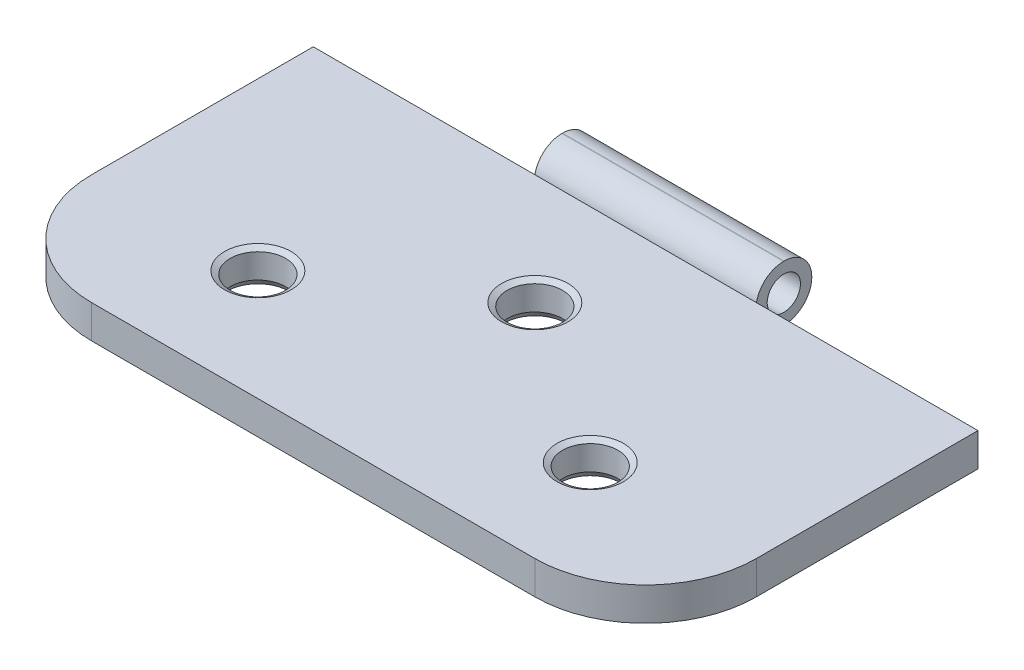
from build123d import *
from OCP.BRepFilletAPI import BRepFilletAPI_MakeChamfer

# Parameters (mm, degrees)
SZKIC1_W                    = 60
SZKIC1_H                    = 30
DODANIE_WYCI_GNI_CIE1_DEPTH = 3
SZKIC2_R                    = 2.5
WYTNIJ_WYCI_GNI_CIE1_DEPTH  = 5
ZAOKR_GLENIE1_R             = 10
SZKIC3_W                    = 20
SZKIC3_H                    = 3
DODANIE_WYCI_GNI_CIE2_DEPTH = 5
SZKIC4_W                    = 20
SZKIC4_H                    = 5
DODANIE_WYCI_GNI_CIE3_DEPTH = 2
ZAOKR_GLENIE2_R             = 2.5
SZKIC5_R                    = 1.5
WYTNIJ_WYCI_GNI_CIE2_DEPTH  = 20
SFAZOWANIE1_SIZE            = 0.5
SFAZOWANIE1_SIZE2           = 0.288675135
SFAZOWANIE2_SIZE            = 0.5
SFAZOWANIE2_SIZE2           = 0.288675135


with BuildPart() as part:
    # Szkic1 → Dodanie-wyciągnięcie1 (new body)
    with BuildSketch(Plane(origin=(0, 0, 0), x_dir=(1, 0, 0), z_dir=(0, 1, 0))):
        Rectangle(SZKIC1_W, SZKIC1_H)
    extrude(amount=DODANIE_WYCI_GNI_CIE1_DEPTH)

    # Szkic2 → Wytnij-wyciągnięcie1 (cut)
    with BuildSketch(Plane(origin=(0, 3, 0), x_dir=(1, 0, 0), z_dir=(0, 1, 0))):
        with Locations(Location((-15, -5, 0), (0, 0, 270))):
            Circle(SZKIC2_R)
        with Locations(Location((15, -5, 0), (0, 0, 270))):
            Circle(SZKIC2_R)
        with Locations(Location((0, 5, 0), (0, 0, 270))):
            Circle(SZKIC2_R)
    extrude(amount=-WYTNIJ_WYCI_GNI_CIE1_DEPTH, mode=Mode.SUBTRACT)

    # Zaokrąglenie1
    zaokr_glenie1_edges = [part.edges().sort_by_distance(p)[0] for p in [
        (30, 1.5, 15),
        (-30, 1.5, 15),
    ]]
    fillet(zaokr_glenie1_edges, radius=ZAOKR_GLENIE1_R)

    # Szkic3 → Dodanie-wyciągnięcie2 (add)
    with BuildSketch(Plane(origin=(0, 0, -15), x_dir=(-1, 0, 0), z_dir=(0, 0, -1))):
        with Locations((0, 1.5)):
            Rectangle(SZKIC3_W, SZKIC3_H)
    extrude(amount=DODANIE_WYCI_GNI_CIE2_DEPTH)

    # Szkic4 → Dodanie-wyciągnięcie3 (add)
    with BuildSketch(Plane(origin=(0, 3, 0), x_dir=(1, 0, 0), z_dir=(0, 1, 0))):
        with Locations((0, 17.5)):
            Rectangle(SZKIC4_W, SZKIC4_H)
    extrude(amount=DODANIE_WYCI_GNI_CIE3_DEPTH)

    # Zaokrąglenie2
    # the kernel refuses this fillet: 2.5 mm, written as the material it takes off along each edge
    with BuildSketch(Plane(origin=(16.25, 0, -20), x_dir=(0, 1, 0), z_dir=(-1, 0, 0)), Plane(origin=(16.25, 5, -20), x_dir=(0, 0, 1), z_dir=(-1, 0, 0))) as zaokr_glenie2_piece_1:
        with BuildLine():
            CenterArc((ZAOKR_GLENIE2_R, -ZAOKR_GLENIE2_R), ZAOKR_GLENIE2_R, 90, 90)
            Line((0, -ZAOKR_GLENIE2_R), (-ZAOKR_GLENIE2_R * 0.02, -ZAOKR_GLENIE2_R))
            Line((-ZAOKR_GLENIE2_R * 0.02, -ZAOKR_GLENIE2_R), (-ZAOKR_GLENIE2_R * 0.02, ZAOKR_GLENIE2_R * 0.02))
            Line((-ZAOKR_GLENIE2_R * 0.02, ZAOKR_GLENIE2_R * 0.02), (ZAOKR_GLENIE2_R, ZAOKR_GLENIE2_R * 0.02))
            Line((ZAOKR_GLENIE2_R, ZAOKR_GLENIE2_R * 0.02), (ZAOKR_GLENIE2_R, 0))
        make_face()
    extrude(amount=32.5, mode=Mode.SUBTRACT)
    with BuildSketch(Plane(origin=(-16.123724357, 5, -15), x_dir=(0, -1.0, -1.666222715356868e-12), z_dir=(1, 0, 0))) as zaokr_glenie2_piece_2:
        with BuildLine():
            CenterArc((2.5, 2.449489743), ZAOKR_GLENIE2_R, 180, 78.463040967)
            Line((0, 2.449489743), (-0.05, 2.449489743))
            Line((-0.05, 2.449489743), (-0.05, 0))
            Line((-0.05, 0), (0, -0.05))
            ThreePointArc((0, -0.05), (1, -0.05), (1.99, -0.048989795))
            Line((1.99, -0.048989795), (2, 0))
        make_face()
    extrude(amount=32.247448714, mode=Mode.SUBTRACT)

    # Szkic5 → Wytnij-wyciągnięcie2 (cut)
    with BuildSketch(Plane(origin=(10, 0, 0), x_dir=(0, 0, -1), z_dir=(1, 0, 0))):
        with Locations((17.474744871, 2.5)):
            Circle(SZKIC5_R)
    extrude(amount=-WYTNIJ_WYCI_GNI_CIE2_DEPTH, mode=Mode.SUBTRACT)

    # Sfazowanie1
    sfazowanie1_edges = [part.edges().sort_by_distance(p)[0] for p in [
        (0, 3, -7.5),
    ]]
    sfazowanie1_side = [part.faces().sort_by_distance(p)[0] for p in [
        (0, 3, -0.380473171),
    ]]
    chamfer(sfazowanie1_edges, length=SFAZOWANIE1_SIZE, length2=SFAZOWANIE1_SIZE2, reference=sfazowanie1_side[0])

    # Sfazowanie2: one chamfer whose edges measure the first distance from different faces: ONE call of the kernel's chamfer builder (chamfer() names one face for all edges)
    sfazowanie2_edges_1 = [part.edges().sort_by_distance(p)[0] for p in [
        (-15, 0, 2.5),
    ]]
    sfazowanie2_side_1 = [part.faces().sort_by_distance(p)[0] for p in [
        (-15, 1.5, 2.5),
    ]]
    sfazowanie2_edges_2 = [part.edges().sort_by_distance(p)[0] for p in [
        (-15, 3, 2.5),
        (15, 3, 2.5),
    ]]
    sfazowanie2_side_2 = [part.faces().sort_by_distance(p)[0] for p in [
        (0, 3, -0.356851383),
    ]]
    sfazowanie2_edges_3 = [part.edges().sort_by_distance(p)[0] for p in [
        (15, 0, 2.5),
    ]]
    sfazowanie2_side_3 = [part.faces().sort_by_distance(p)[0] for p in [
        (15, 1.5, 2.5),
    ]]
    sfazowanie2_edges_4 = [part.edges().sort_by_distance(p)[0] for p in [
        (0, 0, -7.5),
    ]]
    sfazowanie2_side_4 = [part.faces().sort_by_distance(p)[0] for p in [
        (0, 1.355662433, -7.5),
    ]]
    sfazowanie2 = BRepFilletAPI_MakeChamfer(part.part.solid().wrapped)
    for e in sfazowanie2_edges_1:
        sfazowanie2.Add(SFAZOWANIE2_SIZE, SFAZOWANIE2_SIZE2, e.wrapped, sfazowanie2_side_1[0].wrapped)  # the first distance lies on this face
    for e in sfazowanie2_edges_2:
        sfazowanie2.Add(SFAZOWANIE2_SIZE, SFAZOWANIE2_SIZE2, e.wrapped, sfazowanie2_side_2[0].wrapped)  # the first distance lies on this face
    for e in sfazowanie2_edges_3:
        sfazowanie2.Add(SFAZOWANIE2_SIZE, SFAZOWANIE2_SIZE2, e.wrapped, sfazowanie2_side_3[0].wrapped)  # the first distance lies on this face
    for e in sfazowanie2_edges_4:
        sfazowanie2.Add(SFAZOWANIE2_SIZE, SFAZOWANIE2_SIZE2, e.wrapped, sfazowanie2_side_4[0].wrapped)  # the first distance lies on this face
    add(Compound.cast(sfazowanie2.Shape()), mode=Mode.REPLACE)


solid = part.part
